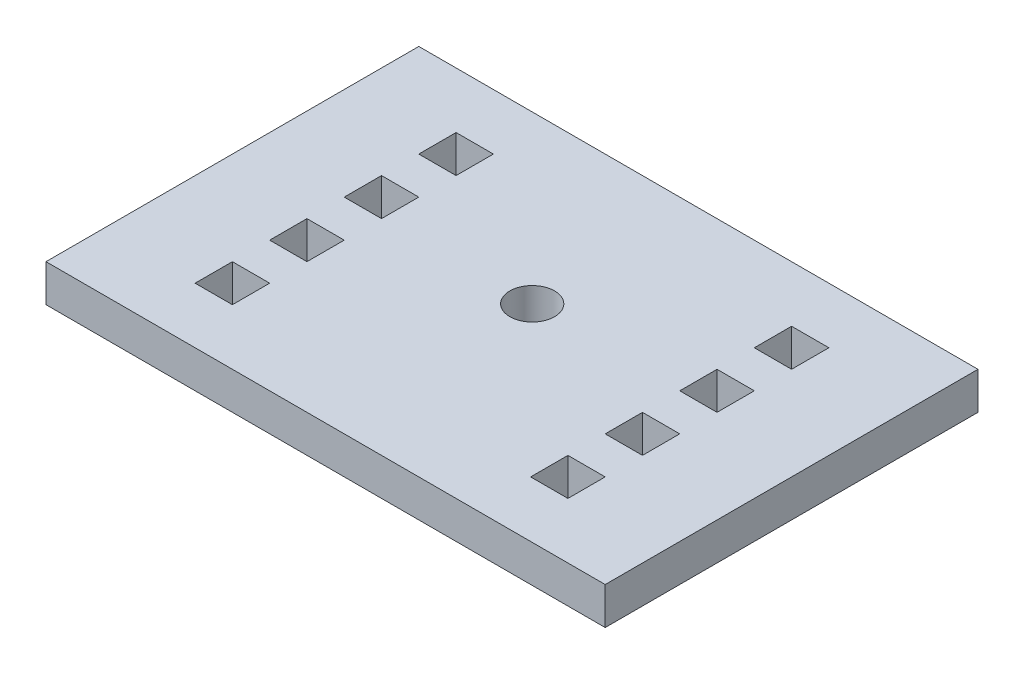
from build123d import *

# Parameters (mm, degrees)
SKETCH1_W           = 76.2
SKETCH1_H           = 50.8
BOSS_EXTRUDE1_DEPTH = 5.08
SKETCH3_R           = 3.048
SKETCH3_W           = 5.08
SKETCH3_H           = 5.08
CUT_EXTRUDE2_DEPTH  = 7.62


with BuildPart() as part:
    # Sketch1 → Boss-Extrude1 (new body)
    with BuildSketch(Plane(origin=(0, 0, 0), x_dir=(1, 0, 0), z_dir=(0, 1, 0))):
        with Locations((-3.310894942, -7.511284047)):
            Rectangle(SKETCH1_W, SKETCH1_H)
    extrude(amount=BOSS_EXTRUDE1_DEPTH)

    # Sketch3 → Cut-Extrude2 (cut)
    with BuildSketch(Plane(origin=(0, 5.08, 0), x_dir=(1, 0, 0), z_dir=(0, 1, 0))):
        with Locations((-3.310894942, -4.755384047)):
            Circle(SKETCH3_R)
        with Locations((19.549105058, -12.591284047)):
            Rectangle(SKETCH3_W, SKETCH3_H)
        with Locations((-26.170894942, -12.591284047)):
            Rectangle(SKETCH3_W, SKETCH3_H)
        with Locations((-26.170894942, -22.751284047)):
            Rectangle(SKETCH3_W, SKETCH3_H)
        with Locations((19.549105058, -22.751284047)):
            Rectangle(SKETCH3_W, SKETCH3_H)
        with Locations((19.549105058, 7.728715953)):
            Rectangle(SKETCH3_W, SKETCH3_H)
        with Locations((19.549105058, -2.431284047)):
            Rectangle(SKETCH3_W, SKETCH3_H)
        with Locations((-26.170894942, 7.728715953)):
            Rectangle(SKETCH3_W, SKETCH3_H)
        with Locations((-26.170894942, -2.431284047)):
            Rectangle(SKETCH3_W, SKETCH3_H)
    extrude(amount=-CUT_EXTRUDE2_DEPTH, mode=Mode.SUBTRACT)


solid = part.part
